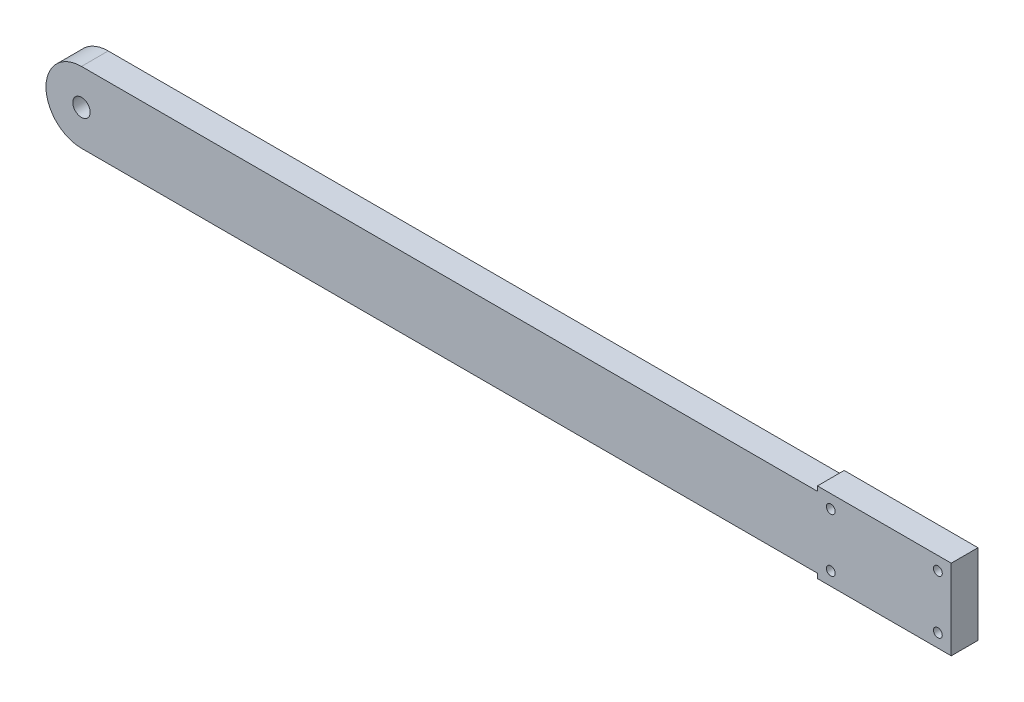
from build123d import *

# Parameters (mm, degrees)
SKETCH1_R      = 3.25
SKETCH1_R_2    = 1.65
MAIN_ARM_DEPTH = 10


with BuildPart() as part:
    # Sketch1 → Main Arm (new body)
    with BuildSketch(Plane.XY):
        with BuildLine():
            Line((275, 13.25), (0, 13.25))
            ThreePointArc((0, 13.25), (-13.25, 0), (0, -13.25))
            Line((0, -13.25), (275, -13.25))
            Line((275, -13.25), (275, -15))
            Line((275, -15), (325, -15))
            Line((325, -15), (325, 15))
            Line((325, 15), (275, 15))
            Line((275, 15), (275, 13.25))
        make_face()
        Circle(SKETCH1_R, mode=Mode.SUBTRACT)
        with Locations((280, 10)):
            Circle(SKETCH1_R_2, mode=Mode.SUBTRACT)
        with Locations((280, -10)):
            Circle(SKETCH1_R_2, mode=Mode.SUBTRACT)
        with Locations((320, 10)):
            Circle(SKETCH1_R_2, mode=Mode.SUBTRACT)
        with Locations((320, -10)):
            Circle(SKETCH1_R_2, mode=Mode.SUBTRACT)
    extrude(amount=MAIN_ARM_DEPTH)


solid = part.part
